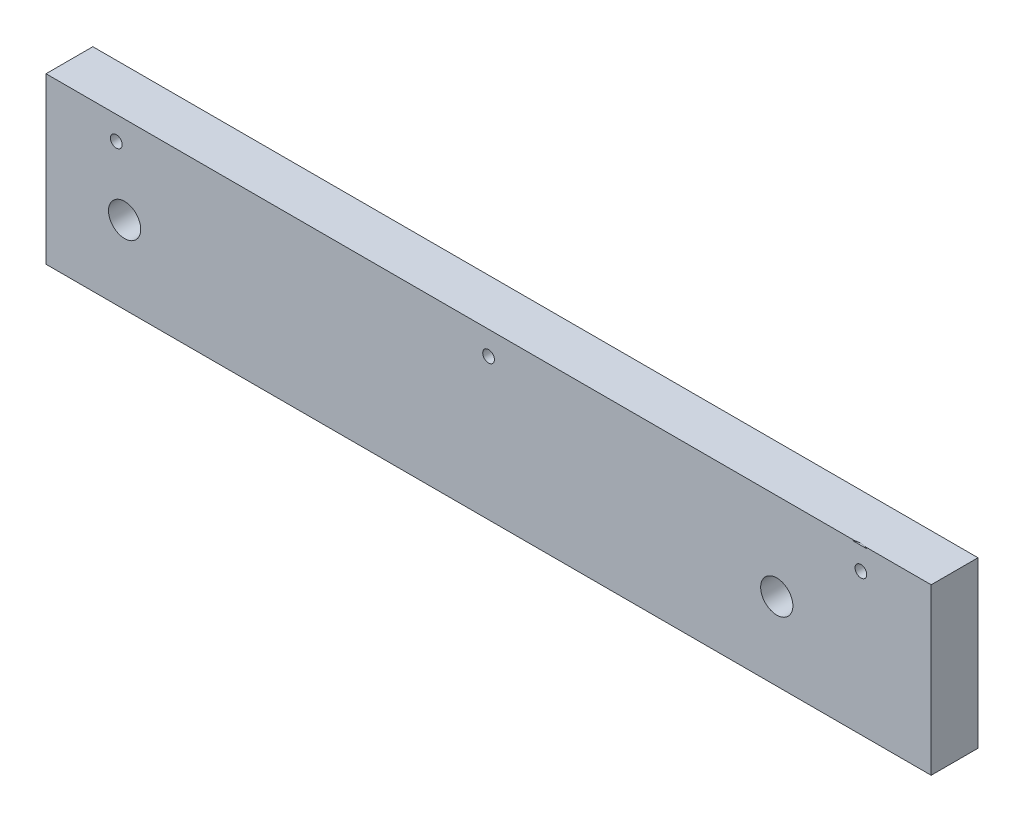
from build123d import *

# Parameters (mm, degrees)
SKETCH1_W                = 240
SKETCH1_H                = 44.741741382
BOSS_EXTRUDE1_DEPTH      = 12.7
HOLE1_D                  = 3.175
HOLE1_DEPTH              = 38.1
HOLE1_CSINK_D            = 10.16
HOLE1_CSINK_ANGLE        = 82
HOLE1_TIP                = 0.953866233
F_5_16_CLEARANCE_HOLE1_D = 8.72998


# Read off the part's stored shape, not the designer's step: Hole2
with BuildPart() as part:
    # Sketch1 → Boss-Extrude1 (new body)
    with BuildSketch(Plane.XY):
        with Locations((128.049945057, -166.420870685)):
            Rectangle(SKETCH1_W, SKETCH1_H)
    extrude(amount=BOSS_EXTRUDE1_DEPTH)

    # Hole1
    with Locations(Plane(origin=(-1072.859770441, -52.974999997, 0), x_dir=(0, 1, 0), z_dir=(0, 0, -1))):
        with Locations((-97.424999997, 1099.959715498), (-97.424999997, 1301.859715498), (-97.424999997, 1200.909715498)):
            CounterSinkHole(HOLE1_D / 2, HOLE1_CSINK_D / 2, depth=HOLE1_DEPTH, counter_sink_angle=HOLE1_CSINK_ANGLE)
            with Locations((0, 0, -(HOLE1_DEPTH + HOLE1_TIP / 2))):  # 118° drill point
                Cone(0, HOLE1_D / 2, HOLE1_TIP, mode=Mode.SUBTRACT)

    # Hole2 outline → Hole2 (revolve, cut)
    with BuildSketch(Plane(origin=(228.697300635, 0, 17.344544827), x_dir=(1, 0, 0), z_dir=(0, 0, 1))):
        Polygon((4.644544827, -144.049999968), (4.644544827, -144.317952856), (5.080000174, -144.317952756), (4.847072326, -144.049999968), align=None)
    revolve(axis=Axis((228.697300635, 0, 17.344544827), (0, 1, 0)), mode=Mode.SUBTRACT)

    # 5/16 Clearance Hole1 (through all)
    with Locations(Plane.XY.offset(12.7)):
        with Locations((29.3624, -167.735499994), (206.1876, -167.735499994)):
            Hole(F_5_16_CLEARANCE_HOLE1_D / 2)


solid = part.part
